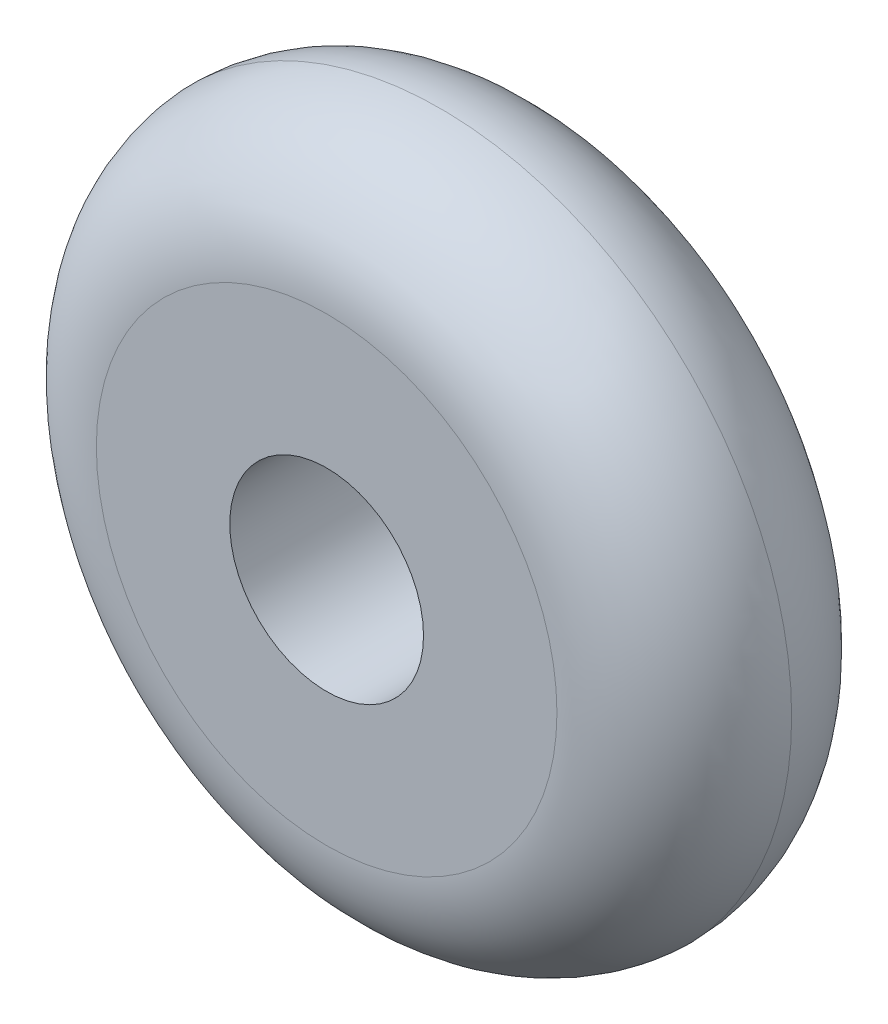
from build123d import *

# Parameters (mm, degrees)
SKETCH1_R           = 14.5
SKETCH1_R_2         = 4
BOSS_EXTRUDE1_DEPTH = 9.7
FILLET1_R           = 5
FILLET2_R           = 5


with BuildPart() as part:
    # Sketch1 → Boss-Extrude1 (new body)
    with BuildSketch(Plane.XY):
        Circle(SKETCH1_R)
        Circle(SKETCH1_R_2, mode=Mode.SUBTRACT)
    extrude(amount=BOSS_EXTRUDE1_DEPTH)

    # Fillet1
    fillet1_edges = [part.edges().sort_by_distance(p)[0] for p in [
        (-14.5, 0, 0),
    ]]
    fillet(fillet1_edges, radius=FILLET1_R)

    # Fillet2
    # the kernel refuses this fillet: 5 mm, written as the material it takes off along each edge
    with BuildSketch(Plane(origin=(0, 0, 9.7), x_dir=(1, 0, 0), z_dir=(0, -1, 0))) as fillet2_piece_1:
        with BuildLine():
            CenterArc((9.509008115, -5), FILLET2_R, 3.439812768, 86.560187232)
            Line((9.509008115, 0), (9.509008115, 0.1))
            Line((9.509008115, 0.1), (14.5, 0.1))
            Line((14.5, 0.1), (14.6, 0))
            ThreePointArc((14.6, 0), (14.6, -2.35), (14.599819838, -4.694))
            Line((14.599819838, -4.694), (14.5, -4.7))
        make_face()
    revolve(axis=Axis((0, 0, 9.7), (0, 0, 1)), mode=Mode.SUBTRACT)


solid = part.part
